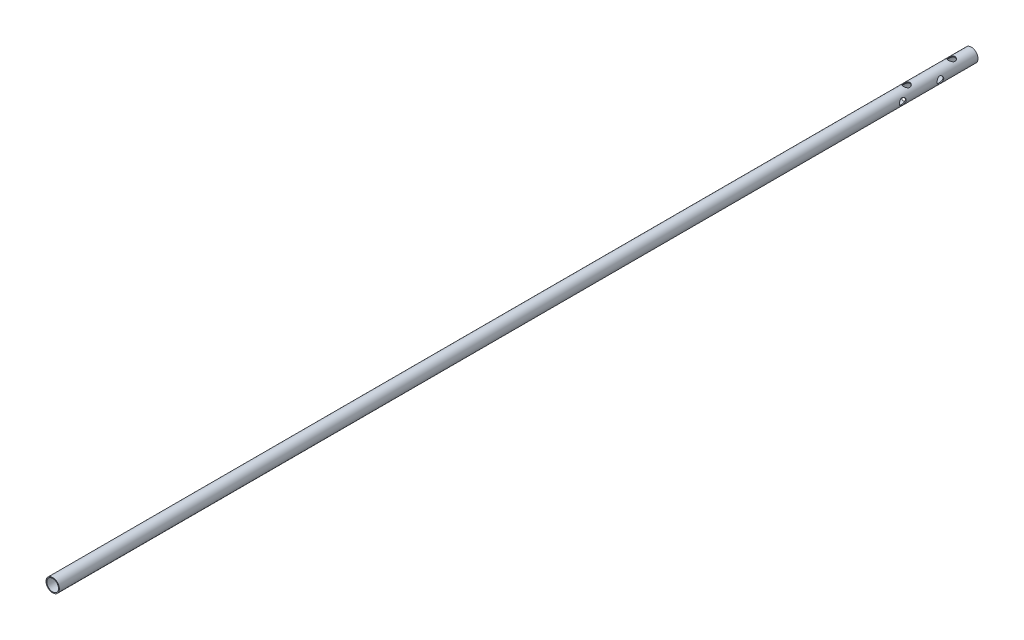
from build123d import *

# Parameters (mm, degrees)
SKETCH_1_R               = 8
SKETCH_1_R_2             = 7
EXTRUDE_1_DEPTH          = 550
CUT_EXTRUDE_1_DEPTH      = 551.116351329
CUT_EXTRUDE_1_DEPTH_BACK = 551.116351329
SKETCH_2_R               = 4
CUT_EXTRUDE_2_DEPTH      = 551.116351432
CUT_EXTRUDE_2_DEPTH_BACK = 551.116351432
SKETCH_3_R               = 4


with BuildPart() as part:
    # Эскиз1 → Бобышка-Вытянуть1 (new, symmetric)
    with BuildSketch(Plane.XY):
        Circle(SKETCH_1_R)
        Circle(SKETCH_1_R_2, mode=Mode.SUBTRACT)
    extrude(amount=EXTRUDE_1_DEPTH, both=True)

    # Эскиз2 → Вырез-Вытянуть1 (cut, two sides: drawn at the far end of the back side and taken through both)
    with BuildSketch(Plane(origin=(0, 0, 0), x_dir=(0, 0, -1), z_dir=(1, 0, 0)).offset(-CUT_EXTRUDE_1_DEPTH_BACK)):
        with Locations((460, 0)):
            Circle(SKETCH_2_R)
        with Locations((505, 0)):
            Circle(SKETCH_2_R)
    extrude(amount=CUT_EXTRUDE_1_DEPTH + CUT_EXTRUDE_1_DEPTH_BACK, mode=Mode.SUBTRACT)

    # Эскиз3 → Вырез-Вытянуть2 (cut, two sides: drawn at the far end of the back side and taken through both)
    with BuildSketch(Plane(origin=(0, 0, 0), x_dir=(1, 0, 0), z_dir=(0, 1, 0)).offset(-CUT_EXTRUDE_2_DEPTH_BACK)):
        with Locations((0, 526.5)):
            Circle(SKETCH_3_R)
        with Locations((0, 472.5)):
            Circle(SKETCH_3_R)
    extrude(amount=CUT_EXTRUDE_2_DEPTH + CUT_EXTRUDE_2_DEPTH_BACK, mode=Mode.SUBTRACT)


solid = part.part
